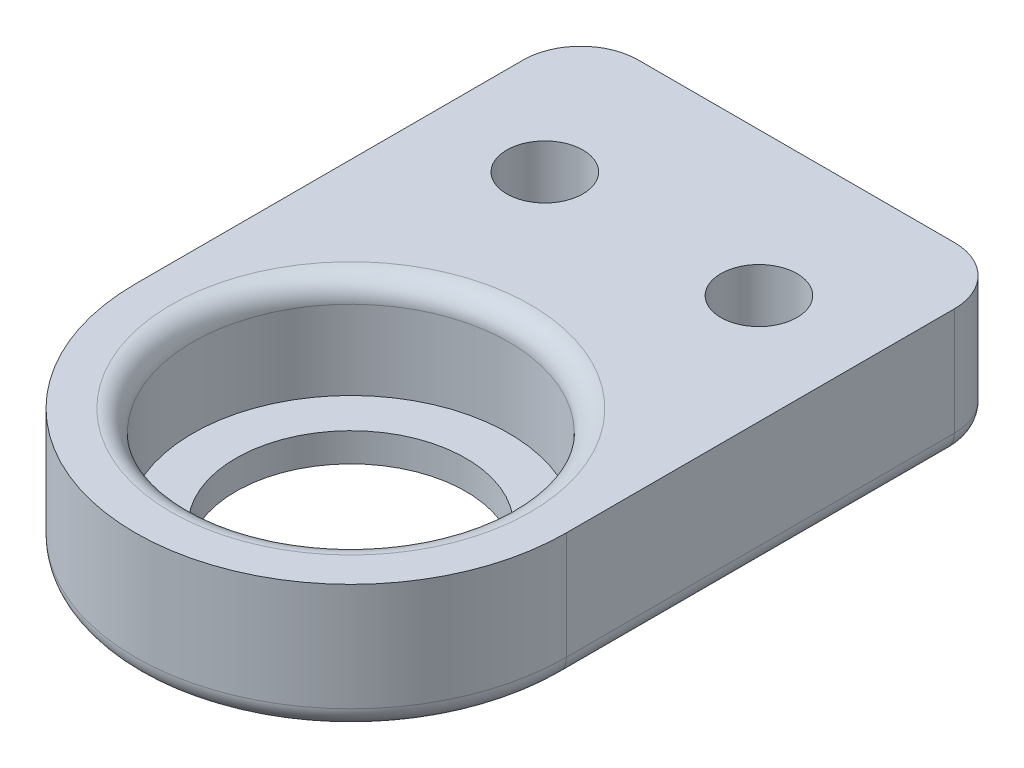
from build123d import *

# Parameters (mm, degrees)
SKETCH2_R                     = 11
BOSS_EXTRUDE1_DEPTH           = 9
SKETCH2_3_R                   = 11
SKETCH2_3_R_2                 = 8
BOSS_EXTRUDE2_DEPTH           = 2
CSK_FOR_M5_SFHCS1_D           = 5.3
CSK_FOR_M5_SFHCS1_CSINK_D     = 11.2
CSK_FOR_M5_SFHCS1_CSINK_ANGLE = 90
FILLET1_R                     = 4
FILLET2_R                     = 1.5


with BuildPart() as part:
    # Sketch2 → Boss-Extrude1 (new body)
    with BuildSketch(Plane(origin=(0, 0, 0), x_dir=(1, 0, 0), z_dir=(0, 1, 0))):
        with BuildLine():
            Line((-15, 31), (-15, 0))
            ThreePointArc((-15, 0), (0, -15), (15, 0))
            Line((15, 0), (15, 31))
            Line((15, 31), (-15, 31))
        make_face()
        Circle(SKETCH2_R, mode=Mode.SUBTRACT)
    extrude(amount=BOSS_EXTRUDE1_DEPTH)

    # Sketch2<3> → Boss-Extrude2 (add)
    with BuildSketch(Plane(origin=(0, 0, 0), x_dir=(1, 0, 0), z_dir=(0, 1, 0))):
        Circle(SKETCH2_3_R)
        Circle(SKETCH2_3_R_2, mode=Mode.SUBTRACT)
    extrude(amount=BOSS_EXTRUDE2_DEPTH)

    # CSK for M5 SFHCS1 (through all)
    with Locations(Plane(origin=(7.4, 0, -21), x_dir=(0, 0, -1), z_dir=(0, -1, 0))):
        with Locations((0, 0), (0, -14.9)):
            CounterSinkHole(CSK_FOR_M5_SFHCS1_D / 2, CSK_FOR_M5_SFHCS1_CSINK_D / 2, counter_sink_angle=CSK_FOR_M5_SFHCS1_CSINK_ANGLE)

    # Fillet1
    fillet1_edges = [part.edges().sort_by_distance(p)[0] for p in [
        (-15, 4.5, -31),
        (15, 4.5, -31),
    ]]
    fillet(fillet1_edges, radius=FILLET1_R)

    # Fillet2
    fillet2_edges = [part.edges().sort_by_distance(p)[0] for p in [
        (0, 0, 15),
        (-15, 0, -13.5),
        (-13.828427125, 0, -29.828427125),
        (0, 0, -31),
        (13.828427125, 0, -29.828427125),
        (-11, 9, 0),
        (15, 0, -13.5),
    ]]
    fillet(fillet2_edges, radius=FILLET2_R)


solid = part.part
